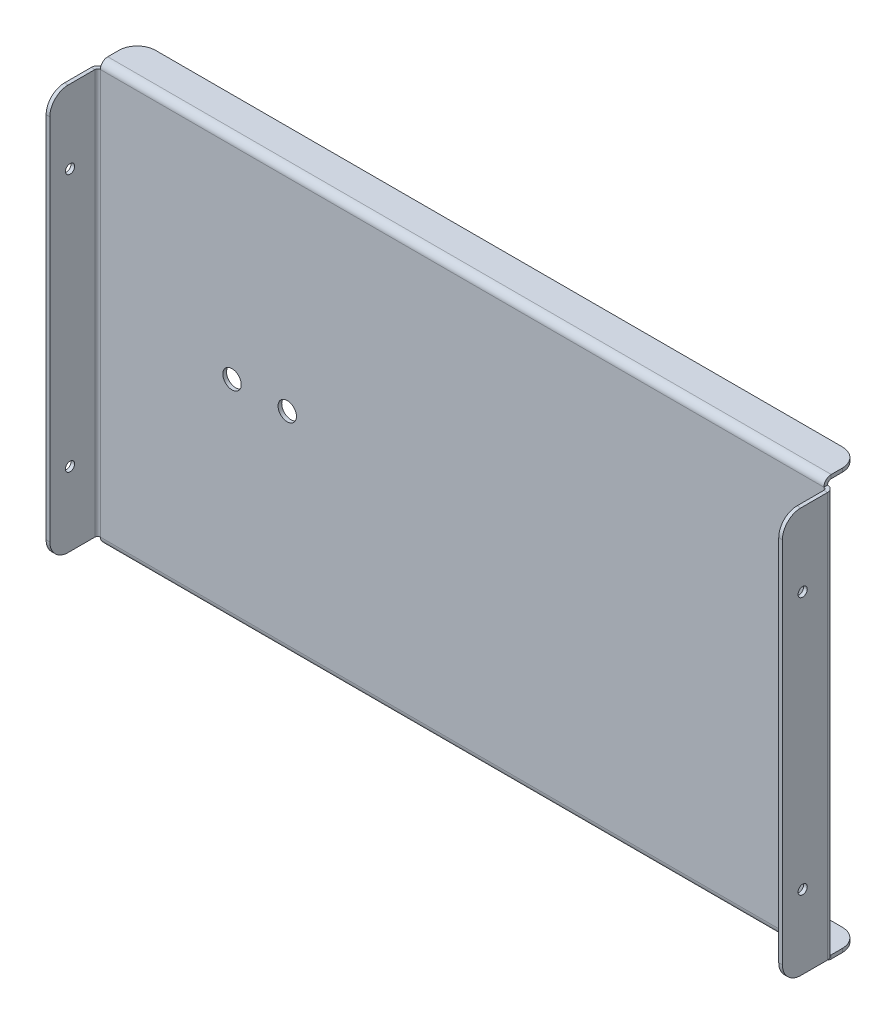
from build123d import *

# Parameters (mm, degrees)
SKETCH1_W                    = 200
SKETCH1_H                    = 110
BASE_FLANGE1_DEPTH           = 1
EDGE_FLANGE1_STRIP_W         = 5.4732
EDGE_FLANGE1_STRIP_H         = 1
EDGE_FLANGE1_STRIP_CUT_DEPTH = 110
EDGE_FLANGE1_DEPTH           = 110
EDGE_FLANGE2_STRIP_W         = 5.4732
EDGE_FLANGE2_STRIP_H         = 1
EDGE_FLANGE2_STRIP_CUT_DEPTH = 110
EDGE_FLANGE2_DEPTH           = 110
CUT_EXTRUDE1_DEPTH           = 207.869524097
CUT_EXTRUDE1_DEPTH_BACK      = 10
SKETCH14_R                   = 1.25
EDGE_FLANGE3_DEPTH           = 196.5268
EDGE_FLANGE3_BEND_DEPTH      = 196.5268
FILLET1_R                    = 5
SKETCH20_R                   = 2.5
CUT_EXTRUDE2_DEPTH           = 116.952576513


# Sheet-metal steps are written as plain solids
with BuildPart() as part:
    # Sketch1 → Base-Flange1 (new body)
    with BuildSketch(Plane.XY):
        Rectangle(SKETCH1_W, SKETCH1_H)
    extrude(amount=-BASE_FLANGE1_DEPTH)

    # Edge-Flange1 strip (across the edge) → Edge-Flange1 strip cut (cut)
    with BuildSketch(Plane(origin=(-100, 55, 0), x_dir=(1, 0, 0), z_dir=(0, -1, 0))):
        with Locations((-1, -0.5)):
            Rectangle(EDGE_FLANGE1_STRIP_W, EDGE_FLANGE1_STRIP_H)
    extrude(amount=EDGE_FLANGE1_STRIP_CUT_DEPTH, mode=Mode.SUBTRACT)

    # Edge-Flange1 section (across the edge) → Edge-Flange1 (add)
    with BuildSketch(Plane(origin=(-100, 55, 0), x_dir=(1, 0, 0), z_dir=(0, -1, 0))):
        with BuildLine():
            Line((0, 0.7366), (0, 13))
            Line((0, 13), (1, 13))
            Line((1, 13), (1, 0.7366))
            ThreePointArc((1, 0.7366), (1.215745145, 0.215745145), (1.7366, 0))
            Line((1.7366, 0), (1.7366, -1))
            ThreePointArc((1.7366, -1), (0.508638364, -0.491361636), (0, 0.7366))
        make_face()
    extrude(amount=EDGE_FLANGE1_DEPTH)

    # Edge-Flange2 strip (across the edge) → Edge-Flange2 strip cut (cut)
    with BuildSketch(Plane(origin=(100, -55, 0), x_dir=(-1, 0, 0), z_dir=(0, 1, 0))):
        with Locations((-1, -0.5)):
            Rectangle(EDGE_FLANGE2_STRIP_W, EDGE_FLANGE2_STRIP_H)
    extrude(amount=EDGE_FLANGE2_STRIP_CUT_DEPTH, mode=Mode.SUBTRACT)

    # Edge-Flange2 section (across the edge) → Edge-Flange2 (add)
    with BuildSketch(Plane(origin=(100, -55, 0), x_dir=(-1, 0, 0), z_dir=(0, 1, 0))):
        with BuildLine():
            Line((0, 0.7366), (0, 13))
            Line((0, 13), (1, 13))
            Line((1, 13), (1, 0.7366))
            ThreePointArc((1, 0.7366), (1.215745145, 0.215745145), (1.7366, 0))
            Line((1.7366, 0), (1.7366, -1))
            ThreePointArc((1.7366, -1), (0.508638364, -0.491361636), (0, 0.7366))
        make_face()
    extrude(amount=EDGE_FLANGE2_DEPTH)

    # Sketch14 → Cut-Extrude1 (cut, two sides: drawn at the far end of the back side and taken through both)
    with BuildSketch(Plane(origin=(-99, 0, 0), x_dir=(0, 0, -1), z_dir=(1, 0, 0)).offset(-CUT_EXTRUDE1_DEPTH_BACK)):
        with Locations(Location((-7.5, -35, 0), (0, 0, 180))):
            Circle(SKETCH14_R)
        with Locations(Location((-7.5, 35, 0), (0, 0, 180))):
            Circle(SKETCH14_R)
    extrude(amount=CUT_EXTRUDE1_DEPTH + CUT_EXTRUDE1_DEPTH_BACK, mode=Mode.SUBTRACT)

    # Edge-Flange3 section (across the edge) → Edge-Flange3 (add)
    with BuildSketch(Plane(origin=(98.2634, -56, -1), x_dir=(0, 1, 0), z_dir=(-1, 0, 0))):
        with BuildLine():
            Line((-1, 1), (-1, 9))
            Line((-1, 9), (0, 9))
            Line((0, 9), (0, 1))
            ThreePointArc((0, 1), (0.292893219, 0.292893219), (1, 0))
            Line((1, 0), (1, -1))
            ThreePointArc((1, -1), (-0.414213562, -0.414213562), (-1, 1))
        make_face()
    extrude(amount=EDGE_FLANGE3_DEPTH)

    # Edge-Flange3 section 2 (across the edge) → Edge-Flange3 bend (add)
    with BuildSketch(Plane(origin=(-98.2634, 56, -1), x_dir=(0, -1, 0), z_dir=(1, 0, 0))):
        with BuildLine():
            Line((-1, 1), (-1, 9))
            Line((-1, 9), (0, 9))
            Line((0, 9), (0, 1))
            ThreePointArc((0, 1), (0.292893219, 0.292893219), (1, 0))
            Line((1, 0), (1, -1))
            ThreePointArc((1, -1), (-0.414213562, -0.414213562), (-1, 1))
        make_face()
    extrude(amount=EDGE_FLANGE3_BEND_DEPTH)

    # Fillet1
    fillet1_edges = [part.edges().sort_by_distance(p)[0] for p in [
        (98.2634, -56.5, -10),
        (-98.2634, -56.5, -10),
        (-98.2634, 56.5, -10),
        (98.2634, 56.5, -10),
        (-99.5, 55, 13),
        (-99.5, -55, 13),
        (99.5, -55, 13),
        (99.5, 55, 13),
    ]]
    fillet(fillet1_edges, radius=FILLET1_R)

    # Sketch20 → Cut-Extrude2 (cut, through all)
    with BuildSketch(Plane(origin=(0, 0, -1), x_dir=(-1, 0, 0), z_dir=(0, 0, -1))):
        with Locations((47.5, 0)):
            Circle(SKETCH20_R)
        with Locations((62.5, 0)):
            Circle(SKETCH20_R)
    extrude(amount=-CUT_EXTRUDE2_DEPTH, mode=Mode.SUBTRACT)


solid = part.part
